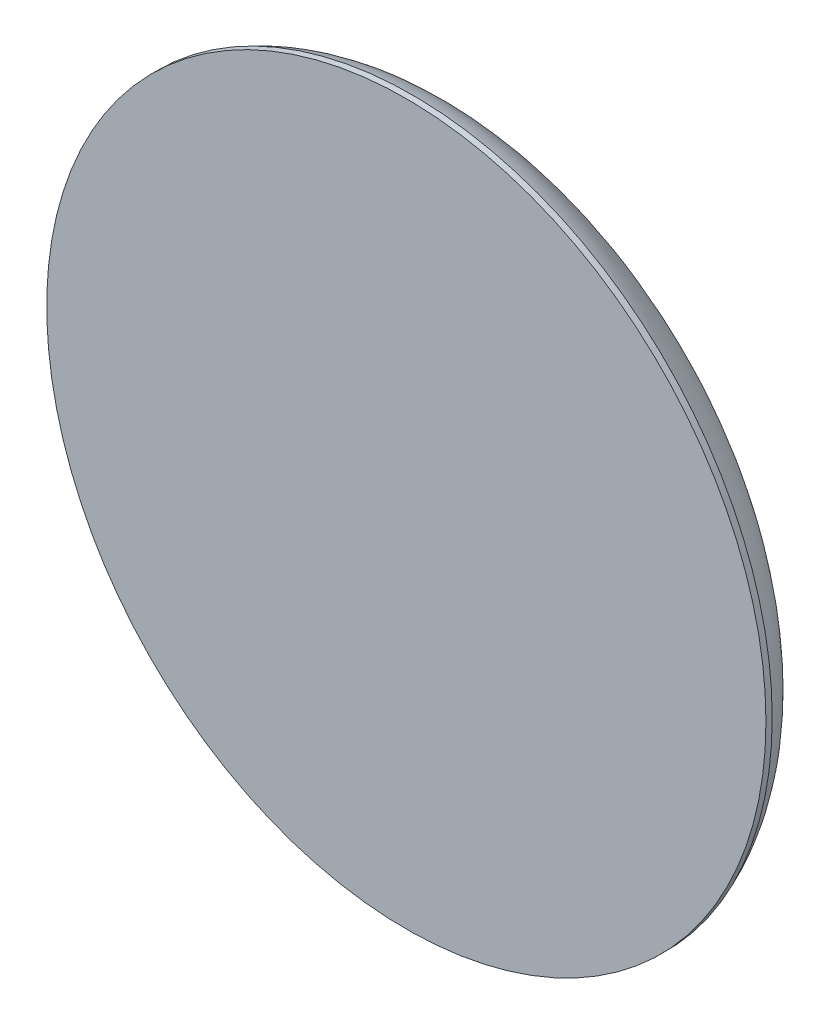
from build123d import *

# Parameters (mm, degrees)
SKETCH1_R = 152.4
SKETCH2_R = 38.1


# Read off the part's stored shape, not the designer's step: Cut-Revolve2
with BuildPart() as part:
    # Sketch1 → Loft2 section 0
    with BuildSketch(Plane.XY):
        Circle(SKETCH1_R)
    # Sketch2 → Loft2 section 1
    with BuildSketch(Plane.XY.offset(-63.5)):
        Circle(SKETCH2_R)
    loft()

    # Cut-Revolve2 outline → Cut-Revolve2 (revolve, cut)
    with BuildSketch(Plane.XZ):
        with BuildLine():
            add(Edge.make_bspline(
                [(38.1, -63.5), (37.997026849, -21.52773095), (74.60779797, -27.328601895), (107.048176751, -25.195457361)],
                knots=[0, 0, 0, 0, 0.621948939, 0.621948939, 0.621948939, 0.621948939], degree=3))
            Line((38.1, -63.5), (107.048176851, -63.5000001))
            Line((107.048176851, -63.5000001), (107.048176751, -25.195457361))
        make_face()
    revolve(axis=Axis((0, 0, 0), (0, 0, 1)), mode=Mode.SUBTRACT)


with BuildPart() as body_2:
    # Sketch8 → Revolve1 (revolve)
    with BuildSketch(Plane(origin=(0, 0, 0), x_dir=(1, 0, 0), z_dir=(0, 1, 0)), mode=Mode.PRIVATE) as revolve1_sk:
        with BuildLine():
            Line((-38.1, 63.5), (0, 63.5))
            Line((0, 63.5), (0, -2.655267609))
            Line((0, -2.655267609), (-152.4, -2.655267609))
            Line((-152.4, -2.655267609), (-152.4, 0))
            add(Edge.make_bspline(
                [(-152.4, 0), (-132.680452173, 52.031950549), (-37.93443472, -3.985072174), (-38.1, 63.5)],
                knots=[0, 0, 0, 0, 1, 1, 1, 1], degree=3))
        make_face()
    revolve(revolve1_sk.sketch.rotate(Axis((0, 0, 0), (0, 0, -1)), 180), axis=Axis((0, 0, 0), (0, 0, -1)))


solid = Compound([part.part, body_2.part])
